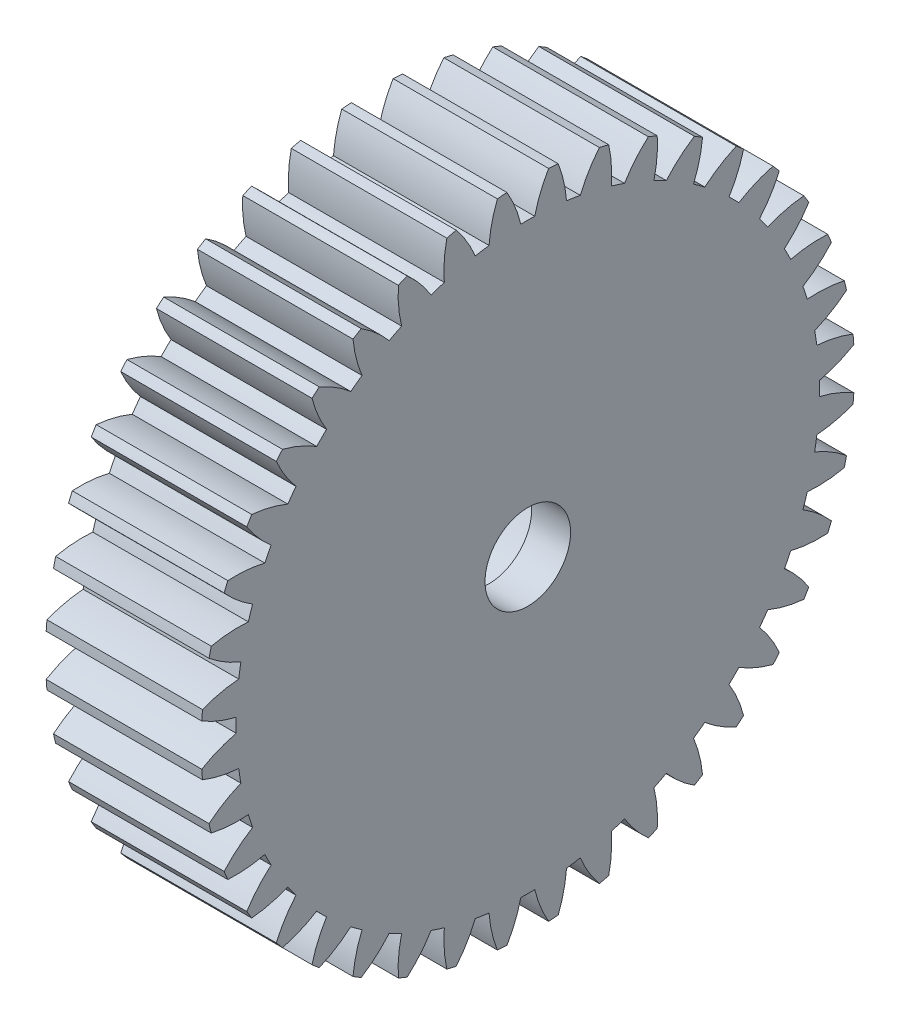
from build123d import *

# Parameters (mm, degrees)
SKETCH1_R           = 0.4
BOSS_EXTRUDE1_DEPTH = 3
SKETCH4_R           = 2.4375
CUT_EXTRUDE2_DEPTH  = 13.228899958
BOSS_EXTRUDE2_START = 1
BOSS_EXTRUDE2_DEPTH = 1
SKETCH6_R           = 1.1
CUT_EXTRUDE4_DEPTH  = 13.228899958


with BuildPart() as part:
    # Sketch1 → Boss-Extrude1 (new body)
    with BuildSketch(Plane(origin=(-1.595003587, 0, 0), x_dir=(0, 0, -1), z_dir=(1, 0, 0))):
        with BuildLine():
            ThreePointArc((-8.382899086, 0.535726523), (-7.953265869, 0.324118302), (-7.496863358, 0.178999427))
            ThreePointArc((-7.496863358, 0.178999427), (-7.499, 0), (-7.496863358, -0.178999427))
            ThreePointArc((-7.496863358, -0.178999427), (-7.953265869, -0.324118302), (-8.382899086, -0.535726523))
            ThreePointArc((-8.382899086, -0.535726523), (-8.374105603, -0.659056404), (-8.36349778, -0.782243493))
            ThreePointArc((-8.36349778, -0.782243493), (-7.906051242, -0.924037024), (-7.432566209, -0.995972162))
            ThreePointArc((-7.432566209, -0.995972162), (-7.406674866, -1.173102053), (-7.37656285, -1.349563456))
            ThreePointArc((-7.37656285, -1.349563456), (-7.804644696, -1.564292759), (-8.195885596, -1.840505175))
            ThreePointArc((-8.195885596, -1.840505175), (-8.167907331, -1.960941056), (-8.138159402, -2.080952079))
            ThreePointArc((-8.138159402, -2.080952079), (-7.664163394, -2.149439492), (-7.185254613, -2.146419611))
            ThreePointArc((-7.185254613, -2.146419611), (-7.131972816, -2.317318441), (-7.074626883, -2.486896753))
            ThreePointArc((-7.074626883, -2.486896753), (-7.463847268, -2.765949137), (-7.807062202, -3.099964481))
            ThreePointArc((-7.807062202, -3.099964481), (-7.760588073, -3.214540832), (-7.71243253, -3.328420718))
            ThreePointArc((-7.71243253, -3.328420718), (-7.233558408, -3.321915625), (-6.761018202, -3.244015085))
            ThreePointArc((-6.761018202, -3.244015085), (-6.681657925, -3.404474758), (-6.598490123, -3.562994399))
            ThreePointArc((-6.598490123, -3.562994399), (-6.939265149, -3.899498668), (-7.226003026, -4.283092373))
            ThreePointArc((-7.226003026, -4.283092373), (-7.162177381, -4.388987944), (-7.096799973, -4.493932593))
            ThreePointArc((-7.096799973, -4.493932593), (-6.624839207, -4.412595171), (-6.170303084, -4.261732142))
            ThreePointArc((-6.170303084, -4.261732142), (-6.066818441, -4.407801607), (-5.959876638, -4.551359298))
            ThreePointArc((-5.959876638, -4.551359298), (-6.243815291, -4.9370296), (-6.467015673, -5.360756316))
            ThreePointArc((-6.467015673, -5.360756316), (-6.387410111, -5.455363606), (-6.306420647, -5.548788933))
            ThreePointArc((-6.306420647, -5.548788933), (-5.852994478, -5.39462198), (-5.427654626, -5.174511209))
            ThreePointArc((-5.427654626, -5.174511209), (-5.302593752, -5.302593752), (-5.174511209, -5.427654626))
            ThreePointArc((-5.174511209, -5.427654626), (-5.39462198, -5.852994478), (-5.548788933, -6.306420647))
            ThreePointArc((-5.548788933, -6.306420647), (-5.455363606, -6.387410111), (-5.360756316, -6.467015673))
            ThreePointArc((-5.360756316, -6.467015673), (-4.9370296, -6.243815291), (-4.551359298, -5.959876638))
            ThreePointArc((-4.551359298, -5.959876638), (-4.407801607, -6.066818441), (-4.261732142, -6.170303084))
            ThreePointArc((-4.261732142, -6.170303084), (-4.412595171, -6.624839207), (-4.493932593, -7.096799973))
            ThreePointArc((-4.493932593, -7.096799973), (-4.388987944, -7.162177381), (-4.283092373, -7.226003026))
            ThreePointArc((-4.283092373, -7.226003026), (-3.899498668, -6.939265149), (-3.562994399, -6.598490123))
            ThreePointArc((-3.562994399, -6.598490123), (-3.404474758, -6.681657925), (-3.244015085, -6.761018202))
            ThreePointArc((-3.244015085, -6.761018202), (-3.321915625, -7.233558408), (-3.328420718, -7.71243253))
            ThreePointArc((-3.328420718, -7.71243253), (-3.214540832, -7.760588073), (-3.099964481, -7.807062202))
            ThreePointArc((-3.099964481, -7.807062202), (-2.765949137, -7.463847268), (-2.486896753, -7.074626883))
            ThreePointArc((-2.486896753, -7.074626883), (-2.317318441, -7.131972816), (-2.146419611, -7.185254613))
            ThreePointArc((-2.146419611, -7.185254613), (-2.149439492, -7.664163394), (-2.080952079, -8.138159402))
            ThreePointArc((-2.080952079, -8.138159402), (-1.960941056, -8.167907331), (-1.840505175, -8.195885596))
            ThreePointArc((-1.840505175, -8.195885596), (-1.564292759, -7.804644696), (-1.349563456, -7.37656285))
            ThreePointArc((-1.349563456, -7.37656285), (-1.173102053, -7.406674866), (-0.995972162, -7.432566209))
            ThreePointArc((-0.995972162, -7.432566209), (-0.924037024, -7.906051242), (-0.782243493, -8.36349778))
            ThreePointArc((-0.782243493, -8.36349778), (-0.659056404, -8.374105603), (-0.535726523, -8.382899086))
            ThreePointArc((-0.535726523, -8.382899086), (-0.324118302, -7.953265869), (-0.178999427, -7.496863358))
            ThreePointArc((-0.178999427, -7.496863358), (0, -7.499), (0.178999427, -7.496863358))
            ThreePointArc((0.178999427, -7.496863358), (0.324118302, -7.953265869), (0.535726523, -8.382899086))
            ThreePointArc((0.535726523, -8.382899086), (0.659056404, -8.374105603), (0.782243493, -8.36349778))
            ThreePointArc((0.782243493, -8.36349778), (0.924037024, -7.906051242), (0.995972162, -7.432566209))
            ThreePointArc((0.995972162, -7.432566209), (1.173102053, -7.406674866), (1.349563456, -7.37656285))
            ThreePointArc((1.349563456, -7.37656285), (1.564292759, -7.804644696), (1.840505175, -8.195885596))
            ThreePointArc((1.840505175, -8.195885596), (1.960941056, -8.167907331), (2.080952079, -8.138159402))
            ThreePointArc((2.080952079, -8.138159402), (2.149439492, -7.664163394), (2.146419611, -7.185254613))
            ThreePointArc((2.146419611, -7.185254613), (2.317318441, -7.131972816), (2.486896753, -7.074626883))
            ThreePointArc((2.486896753, -7.074626883), (2.765949137, -7.463847268), (3.099964481, -7.807062202))
            ThreePointArc((3.099964481, -7.807062202), (3.214540832, -7.760588073), (3.328420718, -7.71243253))
            ThreePointArc((3.328420718, -7.71243253), (3.321915625, -7.233558408), (3.244015085, -6.761018202))
            ThreePointArc((3.244015085, -6.761018202), (3.404474758, -6.681657925), (3.562994399, -6.598490123))
            ThreePointArc((3.562994399, -6.598490123), (3.899498668, -6.939265149), (4.283092373, -7.226003026))
            ThreePointArc((4.283092373, -7.226003026), (4.388987944, -7.162177381), (4.493932593, -7.096799973))
            ThreePointArc((4.493932593, -7.096799973), (4.412595171, -6.624839207), (4.261732142, -6.170303084))
            ThreePointArc((4.261732142, -6.170303084), (4.407801607, -6.066818441), (4.551359298, -5.959876638))
            ThreePointArc((4.551359298, -5.959876638), (4.9370296, -6.243815291), (5.360756316, -6.467015673))
            ThreePointArc((5.360756316, -6.467015673), (5.455363606, -6.387410111), (5.548788933, -6.306420647))
            ThreePointArc((5.548788933, -6.306420647), (5.39462198, -5.852994478), (5.174511209, -5.427654626))
            ThreePointArc((5.174511209, -5.427654626), (5.302593752, -5.302593752), (5.427654626, -5.174511209))
            ThreePointArc((5.427654626, -5.174511209), (5.852994478, -5.39462198), (6.306420647, -5.548788933))
            ThreePointArc((6.306420647, -5.548788933), (6.387410111, -5.455363606), (6.467015673, -5.360756316))
            ThreePointArc((6.467015673, -5.360756316), (6.243815291, -4.9370296), (5.959876638, -4.551359298))
            ThreePointArc((5.959876638, -4.551359298), (6.066818441, -4.407801607), (6.170303084, -4.261732142))
            ThreePointArc((6.170303084, -4.261732142), (6.624839207, -4.412595171), (7.096799973, -4.493932593))
            ThreePointArc((7.096799973, -4.493932593), (7.162177381, -4.388987944), (7.226003026, -4.283092373))
            ThreePointArc((7.226003026, -4.283092373), (6.939265149, -3.899498668), (6.598490123, -3.562994399))
            ThreePointArc((6.598490123, -3.562994399), (6.681657925, -3.404474758), (6.761018202, -3.244015085))
            ThreePointArc((6.761018202, -3.244015085), (7.233558408, -3.321915625), (7.71243253, -3.328420718))
            ThreePointArc((7.71243253, -3.328420718), (7.760588073, -3.214540832), (7.807062202, -3.099964481))
            ThreePointArc((7.807062202, -3.099964481), (7.463847268, -2.765949137), (7.074626883, -2.486896753))
            ThreePointArc((7.074626883, -2.486896753), (7.131972816, -2.317318441), (7.185254613, -2.146419611))
            ThreePointArc((7.185254613, -2.146419611), (7.664163394, -2.149439492), (8.138159402, -2.080952079))
            ThreePointArc((8.138159402, -2.080952079), (8.167907331, -1.960941056), (8.195885596, -1.840505175))
            ThreePointArc((8.195885596, -1.840505175), (7.804644696, -1.564292759), (7.37656285, -1.349563456))
            ThreePointArc((7.37656285, -1.349563456), (7.406674866, -1.173102053), (7.432566209, -0.995972162))
            ThreePointArc((7.432566209, -0.995972162), (7.906051242, -0.924037024), (8.36349778, -0.782243493))
            ThreePointArc((8.36349778, -0.782243493), (8.374105603, -0.659056404), (8.382899086, -0.535726523))
            ThreePointArc((8.382899086, -0.535726523), (7.953265869, -0.324118302), (7.496863358, -0.178999427))
            ThreePointArc((7.496863358, -0.178999427), (7.499, 0), (7.496863358, 0.178999427))
            ThreePointArc((7.496863358, 0.178999427), (7.953265869, 0.324118302), (8.382899086, 0.535726523))
            ThreePointArc((8.382899086, 0.535726523), (8.374105603, 0.659056404), (8.36349778, 0.782243493))
            ThreePointArc((8.36349778, 0.782243493), (7.906051242, 0.924037024), (7.432566209, 0.995972162))
            ThreePointArc((7.432566209, 0.995972162), (7.406674866, 1.173102053), (7.37656285, 1.349563456))
            ThreePointArc((7.37656285, 1.349563456), (7.804644696, 1.564292759), (8.195885596, 1.840505175))
            ThreePointArc((8.195885596, 1.840505175), (8.167907331, 1.960941056), (8.138159402, 2.080952079))
            ThreePointArc((8.138159402, 2.080952079), (7.664163394, 2.149439492), (7.185254613, 2.146419611))
            ThreePointArc((7.185254613, 2.146419611), (7.131972816, 2.317318441), (7.074626883, 2.486896753))
            ThreePointArc((7.074626883, 2.486896753), (7.463847268, 2.765949137), (7.807062202, 3.099964481))
            ThreePointArc((7.807062202, 3.099964481), (7.760588073, 3.214540832), (7.71243253, 3.328420718))
            ThreePointArc((7.71243253, 3.328420718), (7.233558408, 3.321915625), (6.761018202, 3.244015085))
            ThreePointArc((6.761018202, 3.244015085), (6.681657925, 3.404474758), (6.598490123, 3.562994399))
            ThreePointArc((6.598490123, 3.562994399), (6.939265149, 3.899498668), (7.226003026, 4.283092373))
            ThreePointArc((7.226003026, 4.283092373), (7.162177381, 4.388987944), (7.096799973, 4.493932593))
            ThreePointArc((7.096799973, 4.493932593), (6.624839207, 4.412595171), (6.170303084, 4.261732142))
            ThreePointArc((6.170303084, 4.261732142), (6.066818441, 4.407801607), (5.959876638, 4.551359298))
            ThreePointArc((5.959876638, 4.551359298), (6.243815291, 4.9370296), (6.467015673, 5.360756316))
            ThreePointArc((6.467015673, 5.360756316), (6.387410111, 5.455363606), (6.306420647, 5.548788933))
            ThreePointArc((6.306420647, 5.548788933), (5.852994478, 5.39462198), (5.427654626, 5.174511209))
            ThreePointArc((5.427654626, 5.174511209), (5.302593752, 5.302593752), (5.174511209, 5.427654626))
            ThreePointArc((5.174511209, 5.427654626), (5.39462198, 5.852994478), (5.548788933, 6.306420647))
            ThreePointArc((5.548788933, 6.306420647), (5.455363606, 6.387410111), (5.360756316, 6.467015673))
            ThreePointArc((5.360756316, 6.467015673), (4.9370296, 6.243815291), (4.551359298, 5.959876638))
            ThreePointArc((4.551359298, 5.959876638), (4.407801607, 6.066818441), (4.261732142, 6.170303084))
            ThreePointArc((4.261732142, 6.170303084), (4.412595171, 6.624839207), (4.493932593, 7.096799973))
            ThreePointArc((4.493932593, 7.096799973), (4.388987944, 7.162177381), (4.283092373, 7.226003026))
            ThreePointArc((4.283092373, 7.226003026), (3.899498668, 6.939265149), (3.562994399, 6.598490123))
            ThreePointArc((3.562994399, 6.598490123), (3.404474758, 6.681657925), (3.244015085, 6.761018202))
            ThreePointArc((3.244015085, 6.761018202), (3.321915625, 7.233558408), (3.328420718, 7.71243253))
            ThreePointArc((3.328420718, 7.71243253), (3.214540832, 7.760588073), (3.099964481, 7.807062202))
            ThreePointArc((3.099964481, 7.807062202), (2.765949137, 7.463847268), (2.486896753, 7.074626883))
            ThreePointArc((2.486896753, 7.074626883), (2.317318441, 7.131972816), (2.146419611, 7.185254613))
            ThreePointArc((2.146419611, 7.185254613), (2.149439492, 7.664163394), (2.080952079, 8.138159402))
            ThreePointArc((2.080952079, 8.138159402), (1.960941056, 8.167907331), (1.840505175, 8.195885596))
            ThreePointArc((1.840505175, 8.195885596), (1.564292759, 7.804644696), (1.349563456, 7.37656285))
            ThreePointArc((1.349563456, 7.37656285), (1.173102053, 7.406674866), (0.995972162, 7.432566209))
            ThreePointArc((0.995972162, 7.432566209), (0.924037024, 7.906051242), (0.782243493, 8.36349778))
            ThreePointArc((0.782243493, 8.36349778), (0.659056404, 8.374105603), (0.535726523, 8.382899086))
            ThreePointArc((0.535726523, 8.382899086), (0.324118302, 7.953265869), (0.178999427, 7.496863358))
            ThreePointArc((0.178999427, 7.496863358), (0, 7.499), (-0.178999427, 7.496863358))
            ThreePointArc((-0.178999427, 7.496863358), (-0.324118302, 7.953265869), (-0.535726523, 8.382899086))
            ThreePointArc((-0.535726523, 8.382899086), (-0.659056404, 8.374105603), (-0.782243493, 8.36349778))
            ThreePointArc((-0.782243493, 8.36349778), (-0.924037024, 7.906051242), (-0.995972162, 7.432566209))
            ThreePointArc((-0.995972162, 7.432566209), (-1.173102053, 7.406674866), (-1.349563456, 7.37656285))
            ThreePointArc((-1.349563456, 7.37656285), (-1.564292759, 7.804644696), (-1.840505175, 8.195885596))
            ThreePointArc((-1.840505175, 8.195885596), (-1.960941056, 8.167907331), (-2.080952079, 8.138159402))
            ThreePointArc((-2.080952079, 8.138159402), (-2.149439492, 7.664163394), (-2.146419611, 7.185254613))
            ThreePointArc((-2.146419611, 7.185254613), (-2.317318441, 7.131972816), (-2.486896753, 7.074626883))
            ThreePointArc((-2.486896753, 7.074626883), (-2.765949137, 7.463847268), (-3.099964481, 7.807062202))
            ThreePointArc((-3.099964481, 7.807062202), (-3.214540832, 7.760588073), (-3.328420718, 7.71243253))
            ThreePointArc((-3.328420718, 7.71243253), (-3.321915625, 7.233558408), (-3.244015085, 6.761018202))
            ThreePointArc((-3.244015085, 6.761018202), (-3.404474758, 6.681657925), (-3.562994399, 6.598490123))
            ThreePointArc((-3.562994399, 6.598490123), (-3.899498668, 6.939265149), (-4.283092373, 7.226003026))
            ThreePointArc((-4.283092373, 7.226003026), (-4.388987944, 7.162177381), (-4.493932593, 7.096799973))
            ThreePointArc((-4.493932593, 7.096799973), (-4.412595171, 6.624839207), (-4.261732142, 6.170303084))
            ThreePointArc((-4.261732142, 6.170303084), (-4.407801607, 6.066818441), (-4.551359298, 5.959876638))
            ThreePointArc((-4.551359298, 5.959876638), (-4.9370296, 6.243815291), (-5.360756316, 6.467015673))
            ThreePointArc((-5.360756316, 6.467015673), (-5.455363606, 6.387410111), (-5.548788933, 6.306420647))
            ThreePointArc((-5.548788933, 6.306420647), (-5.39462198, 5.852994478), (-5.174511209, 5.427654626))
            ThreePointArc((-5.174511209, 5.427654626), (-5.302593752, 5.302593752), (-5.427654626, 5.174511209))
            ThreePointArc((-5.427654626, 5.174511209), (-5.852994478, 5.39462198), (-6.306420647, 5.548788933))
            ThreePointArc((-6.306420647, 5.548788933), (-6.387410111, 5.455363606), (-6.467015673, 5.360756316))
            ThreePointArc((-6.467015673, 5.360756316), (-6.243815291, 4.9370296), (-5.959876638, 4.551359298))
            ThreePointArc((-5.959876638, 4.551359298), (-6.066818441, 4.407801607), (-6.170303084, 4.261732142))
            ThreePointArc((-6.170303084, 4.261732142), (-6.624839207, 4.412595171), (-7.096799973, 4.493932593))
            ThreePointArc((-7.096799973, 4.493932593), (-7.162177381, 4.388987944), (-7.226003026, 4.283092373))
            ThreePointArc((-7.226003026, 4.283092373), (-6.939265149, 3.899498668), (-6.598490123, 3.562994399))
            ThreePointArc((-6.598490123, 3.562994399), (-6.681657925, 3.404474758), (-6.761018202, 3.244015085))
            ThreePointArc((-6.761018202, 3.244015085), (-7.233558408, 3.321915625), (-7.71243253, 3.328420718))
            ThreePointArc((-7.71243253, 3.328420718), (-7.760588073, 3.214540832), (-7.807062202, 3.099964481))
            ThreePointArc((-7.807062202, 3.099964481), (-7.463847268, 2.765949137), (-7.074626883, 2.486896753))
            ThreePointArc((-7.074626883, 2.486896753), (-7.131972816, 2.317318441), (-7.185254613, 2.146419611))
            ThreePointArc((-7.185254613, 2.146419611), (-7.664163394, 2.149439492), (-8.138159402, 2.080952079))
            ThreePointArc((-8.138159402, 2.080952079), (-8.167907331, 1.960941056), (-8.195885596, 1.840505175))
            ThreePointArc((-8.195885596, 1.840505175), (-7.804644696, 1.564292759), (-7.37656285, 1.349563456))
            ThreePointArc((-7.37656285, 1.349563456), (-7.406674866, 1.173102053), (-7.432566209, 0.995972162))
            ThreePointArc((-7.432566209, 0.995972162), (-7.906051242, 0.924037024), (-8.36349778, 0.782243493))
            ThreePointArc((-8.36349778, 0.782243493), (-8.374105603, 0.659056404), (-8.382899086, 0.535726523))
        make_face()
        Circle(SKETCH1_R, mode=Mode.SUBTRACT)
    extrude(amount=-BOSS_EXTRUDE1_DEPTH)

    # Sketch4 → Cut-Extrude2 (cut, through all)
    with BuildSketch(Plane(origin=(-1.595003587, 0, 0), x_dir=(0, 0, -1), z_dir=(1, 0, 0))):
        Circle(SKETCH4_R)
    extrude(amount=-CUT_EXTRUDE2_DEPTH, mode=Mode.SUBTRACT)

    # Sketch5 → Boss-Extrude2 (add)
    with BuildSketch(Plane(origin=(-1.595003587, 0, 0), x_dir=(0, 0, -1), z_dir=(1, 0, 0)).offset(BOSS_EXTRUDE2_START)):
        with BuildLine():
            ThreePointArc((-8.36349778, 0.782243493), (-8.374105603, 0.659056404), (-8.382899086, 0.535726523))
            ThreePointArc((-8.382899086, 0.535726523), (-7.953265869, 0.324118302), (-7.496863358, 0.178999427))
            ThreePointArc((-7.496863358, 0.178999427), (-7.499, 0), (-7.496863358, -0.178999427))
            ThreePointArc((-7.496863358, -0.178999427), (-7.953265869, -0.324118302), (-8.382899086, -0.535726523))
            ThreePointArc((-8.382899086, -0.535726523), (-8.374105603, -0.659056404), (-8.36349778, -0.782243493))
            ThreePointArc((-8.36349778, -0.782243493), (-7.906051242, -0.924037024), (-7.432566209, -0.995972162))
            ThreePointArc((-7.432566209, -0.995972162), (-7.406674866, -1.173102053), (-7.37656285, -1.349563456))
            ThreePointArc((-7.37656285, -1.349563456), (-7.804644696, -1.564292759), (-8.195885596, -1.840505175))
            ThreePointArc((-8.195885596, -1.840505175), (-8.167907331, -1.960941056), (-8.138159402, -2.080952079))
            ThreePointArc((-8.138159402, -2.080952079), (-7.664163394, -2.149439492), (-7.185254613, -2.146419611))
            ThreePointArc((-7.185254613, -2.146419611), (-7.131972816, -2.317318441), (-7.074626883, -2.486896753))
            ThreePointArc((-7.074626883, -2.486896753), (-7.463847268, -2.765949137), (-7.807062202, -3.099964481))
            ThreePointArc((-7.807062202, -3.099964481), (-7.760588073, -3.214540832), (-7.71243253, -3.328420718))
            ThreePointArc((-7.71243253, -3.328420718), (-7.233558408, -3.321915625), (-6.761018202, -3.244015085))
            ThreePointArc((-6.761018202, -3.244015085), (-6.681657925, -3.404474758), (-6.598490123, -3.562994399))
            ThreePointArc((-6.598490123, -3.562994399), (-6.939265149, -3.899498668), (-7.226003026, -4.283092373))
            ThreePointArc((-7.226003026, -4.283092373), (-7.162177381, -4.388987944), (-7.096799973, -4.493932593))
            ThreePointArc((-7.096799973, -4.493932593), (-6.624839207, -4.412595171), (-6.170303084, -4.261732142))
            ThreePointArc((-6.170303084, -4.261732142), (-6.066818441, -4.407801607), (-5.959876638, -4.551359298))
            ThreePointArc((-5.959876638, -4.551359298), (-6.243815291, -4.9370296), (-6.467015673, -5.360756316))
            ThreePointArc((-6.467015673, -5.360756316), (-6.387410111, -5.455363606), (-6.306420647, -5.548788933))
            ThreePointArc((-6.306420647, -5.548788933), (-5.852994478, -5.39462198), (-5.427654626, -5.174511209))
            ThreePointArc((-5.427654626, -5.174511209), (-5.302593752, -5.302593752), (-5.174511209, -5.427654626))
            ThreePointArc((-5.174511209, -5.427654626), (-5.39462198, -5.852994478), (-5.548788933, -6.306420647))
            ThreePointArc((-5.548788933, -6.306420647), (-5.455363606, -6.387410111), (-5.360756316, -6.467015673))
            ThreePointArc((-5.360756316, -6.467015673), (-4.9370296, -6.243815291), (-4.551359298, -5.959876638))
            ThreePointArc((-4.551359298, -5.959876638), (-4.407801607, -6.066818441), (-4.261732142, -6.170303084))
            ThreePointArc((-4.261732142, -6.170303084), (-4.412595171, -6.624839207), (-4.493932593, -7.096799973))
            ThreePointArc((-4.493932593, -7.096799973), (-4.388987944, -7.162177381), (-4.283092373, -7.226003026))
            ThreePointArc((-4.283092373, -7.226003026), (-3.899498668, -6.939265149), (-3.562994399, -6.598490123))
            ThreePointArc((-3.562994399, -6.598490123), (-3.404474758, -6.681657925), (-3.244015085, -6.761018202))
            ThreePointArc((-3.244015085, -6.761018202), (-3.321915625, -7.233558408), (-3.328420718, -7.71243253))
            ThreePointArc((-3.328420718, -7.71243253), (-3.214540832, -7.760588073), (-3.099964481, -7.807062202))
            ThreePointArc((-3.099964481, -7.807062202), (-2.765949137, -7.463847268), (-2.486896753, -7.074626883))
            ThreePointArc((-2.486896753, -7.074626883), (-2.317318441, -7.131972816), (-2.146419611, -7.185254613))
            ThreePointArc((-2.146419611, -7.185254613), (-2.149439492, -7.664163394), (-2.080952079, -8.138159402))
            ThreePointArc((-2.080952079, -8.138159402), (-1.960941056, -8.167907331), (-1.840505175, -8.195885596))
            ThreePointArc((-1.840505175, -8.195885596), (-1.564292759, -7.804644696), (-1.349563456, -7.37656285))
            ThreePointArc((-1.349563456, -7.37656285), (-1.173102053, -7.406674866), (-0.995972162, -7.432566209))
            ThreePointArc((-0.995972162, -7.432566209), (-0.924037024, -7.906051242), (-0.782243493, -8.36349778))
            ThreePointArc((-0.782243493, -8.36349778), (-0.659056404, -8.374105603), (-0.535726523, -8.382899086))
            ThreePointArc((-0.535726523, -8.382899086), (-0.324118302, -7.953265869), (-0.178999427, -7.496863358))
            ThreePointArc((-0.178999427, -7.496863358), (0, -7.499), (0.178999427, -7.496863358))
            ThreePointArc((0.178999427, -7.496863358), (0.324118302, -7.953265869), (0.535726523, -8.382899086))
            ThreePointArc((0.535726523, -8.382899086), (0.659056404, -8.374105603), (0.782243493, -8.36349778))
            ThreePointArc((0.782243493, -8.36349778), (0.924037024, -7.906051242), (0.995972162, -7.432566209))
            ThreePointArc((0.995972162, -7.432566209), (1.173102053, -7.406674866), (1.349563456, -7.37656285))
            ThreePointArc((1.349563456, -7.37656285), (1.564292759, -7.804644696), (1.840505175, -8.195885596))
            ThreePointArc((1.840505175, -8.195885596), (1.960941056, -8.167907331), (2.080952079, -8.138159402))
            ThreePointArc((2.080952079, -8.138159402), (2.149439492, -7.664163394), (2.146419611, -7.185254613))
            ThreePointArc((2.146419611, -7.185254613), (2.317318441, -7.131972816), (2.486896753, -7.074626883))
            ThreePointArc((2.486896753, -7.074626883), (2.765949137, -7.463847268), (3.099964481, -7.807062202))
            ThreePointArc((3.099964481, -7.807062202), (3.214540832, -7.760588073), (3.328420718, -7.71243253))
            ThreePointArc((3.328420718, -7.71243253), (3.321915625, -7.233558408), (3.244015085, -6.761018202))
            ThreePointArc((3.244015085, -6.761018202), (3.404474758, -6.681657925), (3.562994399, -6.598490123))
            ThreePointArc((3.562994399, -6.598490123), (3.899498668, -6.939265149), (4.283092373, -7.226003026))
            ThreePointArc((4.283092373, -7.226003026), (4.388987944, -7.162177381), (4.493932593, -7.096799973))
            ThreePointArc((4.493932593, -7.096799973), (4.412595171, -6.624839207), (4.261732142, -6.170303084))
            ThreePointArc((4.261732142, -6.170303084), (4.407801607, -6.066818441), (4.551359298, -5.959876638))
            ThreePointArc((4.551359298, -5.959876638), (4.9370296, -6.243815291), (5.360756316, -6.467015673))
            ThreePointArc((5.360756316, -6.467015673), (5.455363606, -6.387410111), (5.548788933, -6.306420647))
            ThreePointArc((5.548788933, -6.306420647), (5.39462198, -5.852994478), (5.174511209, -5.427654626))
            ThreePointArc((5.174511209, -5.427654626), (5.302593752, -5.302593752), (5.427654626, -5.174511209))
            ThreePointArc((5.427654626, -5.174511209), (5.852994478, -5.39462198), (6.306420647, -5.548788933))
            ThreePointArc((6.306420647, -5.548788933), (6.387410111, -5.455363606), (6.467015673, -5.360756316))
            ThreePointArc((6.467015673, -5.360756316), (6.243815291, -4.9370296), (5.959876638, -4.551359298))
            ThreePointArc((5.959876638, -4.551359298), (6.066818441, -4.407801607), (6.170303084, -4.261732142))
            ThreePointArc((6.170303084, -4.261732142), (6.624839207, -4.412595171), (7.096799973, -4.493932593))
            ThreePointArc((7.096799973, -4.493932593), (7.162177381, -4.388987944), (7.226003026, -4.283092373))
            ThreePointArc((7.226003026, -4.283092373), (6.939265149, -3.899498668), (6.598490123, -3.562994399))
            ThreePointArc((6.598490123, -3.562994399), (6.681657925, -3.404474758), (6.761018202, -3.244015085))
            ThreePointArc((6.761018202, -3.244015085), (7.233558408, -3.321915625), (7.71243253, -3.328420718))
            ThreePointArc((7.71243253, -3.328420718), (7.760588073, -3.214540832), (7.807062202, -3.099964481))
            ThreePointArc((7.807062202, -3.099964481), (7.463847268, -2.765949137), (7.074626883, -2.486896753))
            ThreePointArc((7.074626883, -2.486896753), (7.131972816, -2.317318441), (7.185254613, -2.146419611))
            ThreePointArc((7.185254613, -2.146419611), (7.664163394, -2.149439492), (8.138159402, -2.080952079))
            ThreePointArc((8.138159402, -2.080952079), (8.167907331, -1.960941056), (8.195885596, -1.840505175))
            ThreePointArc((8.195885596, -1.840505175), (7.804644696, -1.564292759), (7.37656285, -1.349563456))
            ThreePointArc((7.37656285, -1.349563456), (7.406674866, -1.173102053), (7.432566209, -0.995972162))
            ThreePointArc((7.432566209, -0.995972162), (7.906051242, -0.924037024), (8.36349778, -0.782243493))
            ThreePointArc((8.36349778, -0.782243493), (8.374105603, -0.659056404), (8.382899086, -0.535726523))
            ThreePointArc((8.382899086, -0.535726523), (7.953265869, -0.324118302), (7.496863358, -0.178999427))
            ThreePointArc((7.496863358, -0.178999427), (7.499, 0), (7.496863358, 0.178999427))
            ThreePointArc((7.496863358, 0.178999427), (7.953265869, 0.324118302), (8.382899086, 0.535726523))
            ThreePointArc((8.382899086, 0.535726523), (8.374105603, 0.659056404), (8.36349778, 0.782243493))
            ThreePointArc((8.36349778, 0.782243493), (7.906051242, 0.924037024), (7.432566209, 0.995972162))
            ThreePointArc((7.432566209, 0.995972162), (7.406674866, 1.173102053), (7.37656285, 1.349563456))
            ThreePointArc((7.37656285, 1.349563456), (7.804644696, 1.564292759), (8.195885596, 1.840505175))
            ThreePointArc((8.195885596, 1.840505175), (8.167907331, 1.960941056), (8.138159402, 2.080952079))
            ThreePointArc((8.138159402, 2.080952079), (7.664163394, 2.149439492), (7.185254613, 2.146419611))
            ThreePointArc((7.185254613, 2.146419611), (7.131972816, 2.317318441), (7.074626883, 2.486896753))
            ThreePointArc((7.074626883, 2.486896753), (7.463847268, 2.765949137), (7.807062202, 3.099964481))
            ThreePointArc((7.807062202, 3.099964481), (7.760588073, 3.214540832), (7.71243253, 3.328420718))
            ThreePointArc((7.71243253, 3.328420718), (7.233558408, 3.321915625), (6.761018202, 3.244015085))
            ThreePointArc((6.761018202, 3.244015085), (6.681657925, 3.404474758), (6.598490123, 3.562994399))
            ThreePointArc((6.598490123, 3.562994399), (6.939265149, 3.899498668), (7.226003026, 4.283092373))
            ThreePointArc((7.226003026, 4.283092373), (7.162177381, 4.388987944), (7.096799973, 4.493932593))
            ThreePointArc((7.096799973, 4.493932593), (6.624839207, 4.412595171), (6.170303084, 4.261732142))
            ThreePointArc((6.170303084, 4.261732142), (6.066818441, 4.407801607), (5.959876638, 4.551359298))
            ThreePointArc((5.959876638, 4.551359298), (6.243815291, 4.9370296), (6.467015673, 5.360756316))
            ThreePointArc((6.467015673, 5.360756316), (6.387410111, 5.455363606), (6.306420647, 5.548788933))
            ThreePointArc((6.306420647, 5.548788933), (5.852994478, 5.39462198), (5.427654626, 5.174511209))
            ThreePointArc((5.427654626, 5.174511209), (5.302593752, 5.302593752), (5.174511209, 5.427654626))
            ThreePointArc((5.174511209, 5.427654626), (5.39462198, 5.852994478), (5.548788933, 6.306420647))
            ThreePointArc((5.548788933, 6.306420647), (5.455363606, 6.387410111), (5.360756316, 6.467015673))
            ThreePointArc((5.360756316, 6.467015673), (4.9370296, 6.243815291), (4.551359298, 5.959876638))
            ThreePointArc((4.551359298, 5.959876638), (4.407801607, 6.066818441), (4.261732142, 6.170303084))
            ThreePointArc((4.261732142, 6.170303084), (4.412595171, 6.624839207), (4.493932593, 7.096799973))
            ThreePointArc((4.493932593, 7.096799973), (4.388987944, 7.162177381), (4.283092373, 7.226003026))
            ThreePointArc((4.283092373, 7.226003026), (3.899498668, 6.939265149), (3.562994399, 6.598490123))
            ThreePointArc((3.562994399, 6.598490123), (3.404474758, 6.681657925), (3.244015085, 6.761018202))
            ThreePointArc((3.244015085, 6.761018202), (3.321915625, 7.233558408), (3.328420718, 7.71243253))
            ThreePointArc((3.328420718, 7.71243253), (3.214540832, 7.760588073), (3.099964481, 7.807062202))
            ThreePointArc((3.099964481, 7.807062202), (2.765949137, 7.463847268), (2.486896753, 7.074626883))
            ThreePointArc((2.486896753, 7.074626883), (2.317318441, 7.131972816), (2.146419611, 7.185254613))
            ThreePointArc((2.146419611, 7.185254613), (2.149439492, 7.664163394), (2.080952079, 8.138159402))
            ThreePointArc((2.080952079, 8.138159402), (1.960941056, 8.167907331), (1.840505175, 8.195885596))
            ThreePointArc((1.840505175, 8.195885596), (1.564292759, 7.804644696), (1.349563456, 7.37656285))
            ThreePointArc((1.349563456, 7.37656285), (1.173102053, 7.406674866), (0.995972162, 7.432566209))
            ThreePointArc((0.995972162, 7.432566209), (0.924037024, 7.906051242), (0.782243493, 8.36349778))
            ThreePointArc((0.782243493, 8.36349778), (0.659056404, 8.374105603), (0.535726523, 8.382899086))
            ThreePointArc((0.535726523, 8.382899086), (0.324118302, 7.953265869), (0.178999427, 7.496863358))
            ThreePointArc((0.178999427, 7.496863358), (0, 7.499), (-0.178999427, 7.496863358))
            ThreePointArc((-0.178999427, 7.496863358), (-0.324118302, 7.953265869), (-0.535726523, 8.382899086))
            ThreePointArc((-0.535726523, 8.382899086), (-0.659056404, 8.374105603), (-0.782243493, 8.36349778))
            ThreePointArc((-0.782243493, 8.36349778), (-0.924037024, 7.906051242), (-0.995972162, 7.432566209))
            ThreePointArc((-0.995972162, 7.432566209), (-1.173102053, 7.406674866), (-1.349563456, 7.37656285))
            ThreePointArc((-1.349563456, 7.37656285), (-1.564292759, 7.804644696), (-1.840505175, 8.195885596))
            ThreePointArc((-1.840505175, 8.195885596), (-1.960941056, 8.167907331), (-2.080952079, 8.138159402))
            ThreePointArc((-2.080952079, 8.138159402), (-2.149439492, 7.664163394), (-2.146419611, 7.185254613))
            ThreePointArc((-2.146419611, 7.185254613), (-2.317318441, 7.131972816), (-2.486896753, 7.074626883))
            ThreePointArc((-2.486896753, 7.074626883), (-2.765949137, 7.463847268), (-3.099964481, 7.807062202))
            ThreePointArc((-3.099964481, 7.807062202), (-3.214540832, 7.760588073), (-3.328420718, 7.71243253))
            ThreePointArc((-3.328420718, 7.71243253), (-3.321915625, 7.233558408), (-3.244015085, 6.761018202))
            ThreePointArc((-3.244015085, 6.761018202), (-3.404474758, 6.681657925), (-3.562994399, 6.598490123))
            ThreePointArc((-3.562994399, 6.598490123), (-3.899498668, 6.939265149), (-4.283092373, 7.226003026))
            ThreePointArc((-4.283092373, 7.226003026), (-4.388987944, 7.162177381), (-4.493932593, 7.096799973))
            ThreePointArc((-4.493932593, 7.096799973), (-4.412595171, 6.624839207), (-4.261732142, 6.170303084))
            ThreePointArc((-4.261732142, 6.170303084), (-4.407801607, 6.066818441), (-4.551359298, 5.959876638))
            ThreePointArc((-4.551359298, 5.959876638), (-4.9370296, 6.243815291), (-5.360756316, 6.467015673))
            ThreePointArc((-5.360756316, 6.467015673), (-5.455363606, 6.387410111), (-5.548788933, 6.306420647))
            ThreePointArc((-5.548788933, 6.306420647), (-5.39462198, 5.852994478), (-5.174511209, 5.427654626))
            ThreePointArc((-5.174511209, 5.427654626), (-5.302593752, 5.302593752), (-5.427654626, 5.174511209))
            ThreePointArc((-5.427654626, 5.174511209), (-5.852994478, 5.39462198), (-6.306420647, 5.548788933))
            ThreePointArc((-6.306420647, 5.548788933), (-6.387410111, 5.455363606), (-6.467015673, 5.360756316))
            ThreePointArc((-6.467015673, 5.360756316), (-6.243815291, 4.9370296), (-5.959876638, 4.551359298))
            ThreePointArc((-5.959876638, 4.551359298), (-6.066818441, 4.407801607), (-6.170303084, 4.261732142))
            ThreePointArc((-6.170303084, 4.261732142), (-6.624839207, 4.412595171), (-7.096799973, 4.493932593))
            ThreePointArc((-7.096799973, 4.493932593), (-7.162177381, 4.388987944), (-7.226003026, 4.283092373))
            ThreePointArc((-7.226003026, 4.283092373), (-6.939265149, 3.899498668), (-6.598490123, 3.562994399))
            ThreePointArc((-6.598490123, 3.562994399), (-6.681657925, 3.404474758), (-6.761018202, 3.244015085))
            ThreePointArc((-6.761018202, 3.244015085), (-7.233558408, 3.321915625), (-7.71243253, 3.328420718))
            ThreePointArc((-7.71243253, 3.328420718), (-7.760588073, 3.214540832), (-7.807062202, 3.099964481))
            ThreePointArc((-7.807062202, 3.099964481), (-7.463847268, 2.765949137), (-7.074626883, 2.486896753))
            ThreePointArc((-7.074626883, 2.486896753), (-7.131972816, 2.317318441), (-7.185254613, 2.146419611))
            ThreePointArc((-7.185254613, 2.146419611), (-7.664163394, 2.149439492), (-8.138159402, 2.080952079))
            ThreePointArc((-8.138159402, 2.080952079), (-8.167907331, 1.960941056), (-8.195885596, 1.840505175))
            ThreePointArc((-8.195885596, 1.840505175), (-7.804644696, 1.564292759), (-7.37656285, 1.349563456))
            ThreePointArc((-7.37656285, 1.349563456), (-7.406674866, 1.173102053), (-7.432566209, 0.995972162))
            ThreePointArc((-7.432566209, 0.995972162), (-7.906051242, 0.924037024), (-8.36349778, 0.782243493))
        make_face()
    extrude(amount=-BOSS_EXTRUDE2_DEPTH)

    # Sketch6 → Cut-Extrude4 (cut, through all)
    with BuildSketch(Plane(origin=(-1.595003587, 0, 0), x_dir=(0, 0, -1), z_dir=(1, 0, 0))):
        Circle(SKETCH6_R)
    extrude(amount=CUT_EXTRUDE4_DEPTH, mode=Mode.SUBTRACT)


solid = part.part
